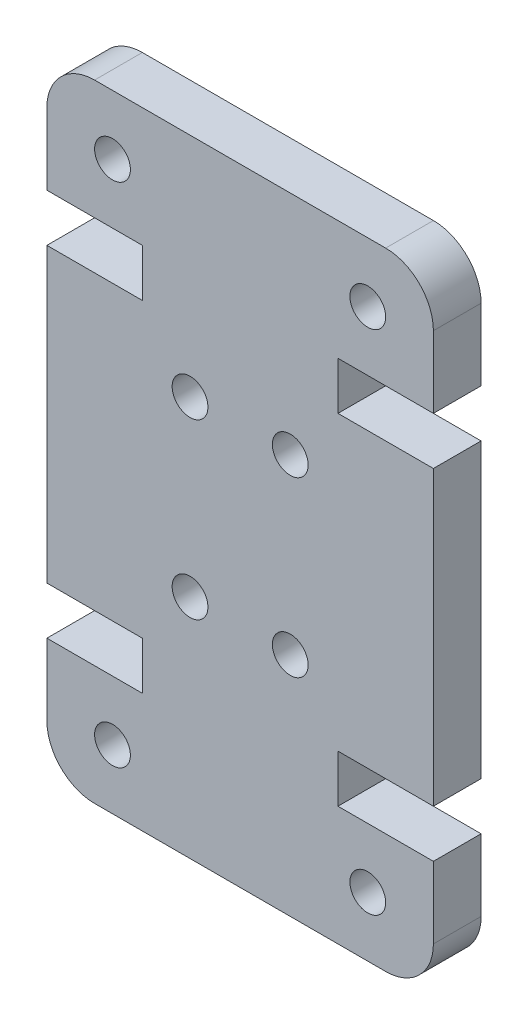
from build123d import *

# Parameters (mm, degrees)
SKETCH2_R           = 0.75
BOSS_EXTRUDE1_DEPTH = 4
SKETCH3_W           = 16.2
SKETCH3_H           = 26.26
CUT_EXTRUDE1_DEPTH  = 2


with BuildPart() as part:
    # Sketch2 → Boss-Extrude1 (new body)
    with BuildSketch(Plane.XY):
        with BuildLine():
            Line((0, 7), (0, 19.26))
            Line((0, 19.26), (4, 19.26))
            Line((4, 19.26), (4, 21.26))
            Line((4, 21.26), (0, 21.26))
            Line((0, 21.26), (0, 24.26))
            ThreePointArc((0, 24.26), (0.585786438, 25.674213562), (2, 26.26))
            Line((2, 26.26), (14.2, 26.26))
            ThreePointArc((14.2, 26.26), (15.614213562, 25.674213562), (16.2, 24.26))
            Line((16.2, 24.26), (16.2, 21.26))
            Line((16.2, 21.26), (12.2, 21.26))
            Line((12.2, 21.26), (12.2, 19.26))
            Line((12.2, 19.26), (16.2, 19.26))
            Line((16.2, 19.26), (16.2, 7))
            Line((16.2, 7), (12.2, 7))
            Line((12.2, 7), (12.2, 5))
            Line((12.2, 5), (16.2, 5))
            Line((16.2, 5), (16.2, 2))
            ThreePointArc((16.2, 2), (15.614213562, 0.585786438), (14.2, 0))
            Line((14.2, 0), (2, 0))
            ThreePointArc((2, 0), (0.585786438, 0.585786438), (0, 2))
            Line((0, 2), (0, 5))
            Line((0, 5), (4, 5))
            Line((4, 5), (4, 7))
            Line((4, 7), (0, 7))
        make_face()
        with Locations((13.45, 2.5)):
            Circle(SKETCH2_R, mode=Mode.SUBTRACT)
        with Locations((10.2, 9.5)):
            Circle(SKETCH2_R, mode=Mode.SUBTRACT)
        with Locations((2.75, 23.76)):
            Circle(SKETCH2_R, mode=Mode.SUBTRACT)
        with Locations((6, 16.76)):
            Circle(SKETCH2_R, mode=Mode.SUBTRACT)
        with Locations((10.2, 16.76)):
            Circle(SKETCH2_R, mode=Mode.SUBTRACT)
        with Locations((13.45, 23.76)):
            Circle(SKETCH2_R, mode=Mode.SUBTRACT)
        with Locations((6, 9.5)):
            Circle(SKETCH2_R, mode=Mode.SUBTRACT)
        with Locations((2.75, 2.5)):
            Circle(SKETCH2_R, mode=Mode.SUBTRACT)
    extrude(amount=BOSS_EXTRUDE1_DEPTH)

    # Sketch3 → Cut-Extrude1 (cut)
    with BuildSketch(Plane.XY.offset(4)):
        with Locations((8.1, 13.13)):
            Rectangle(SKETCH3_W, SKETCH3_H)
    extrude(amount=-CUT_EXTRUDE1_DEPTH, mode=Mode.SUBTRACT)


solid = part.part
